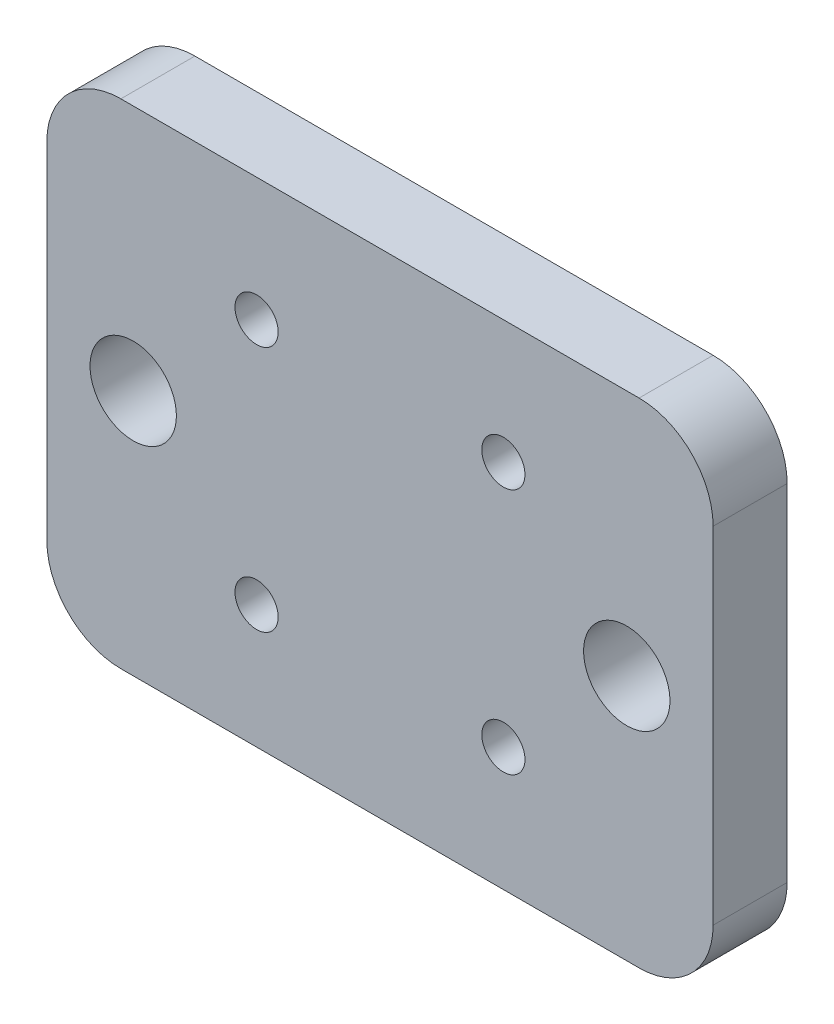
from build123d import *

# Parameters (mm, degrees)
ESQUISSE1_W                  = 54
ESQUISSE1_H                  = 40
BOSS_EXTRU_1_DEPTH           = 6
ENL_V_MAT_EXTRU_1_DEPTH      = 68.468511174
ENL_V_MAT_EXTRU_1_DEPTH_BACK = 68.468511174
ESQUISSE2_R                  = 1.75
ESQUISSE2_R_2                = 3.5
CONG_1_R                     = 6


with BuildPart() as part:
    # Esquisse1 → Boss.-Extru.1 (new body)
    with BuildSketch(Plane.XY):
        with Locations((27, 20)):
            Rectangle(ESQUISSE1_W, ESQUISSE1_H)
    extrude(amount=BOSS_EXTRU_1_DEPTH)

    # Esquisse2 → Enlèv. mat.-Extru.1 (cut, two sides: drawn at the far end of the back side and taken through both)
    with BuildSketch(Plane.XY.offset(6).offset(-ENL_V_MAT_EXTRU_1_DEPTH_BACK)):
        with Locations((17, 30)):
            Circle(ESQUISSE2_R)
        with Locations((37, 30)):
            Circle(ESQUISSE2_R)
        with Locations((37, 10)):
            Circle(ESQUISSE2_R)
        with Locations((17, 10)):
            Circle(ESQUISSE2_R)
        with Locations((7, 20)):
            Circle(ESQUISSE2_R_2)
        with Locations((47, 20)):
            Circle(ESQUISSE2_R_2)
    extrude(amount=ENL_V_MAT_EXTRU_1_DEPTH + ENL_V_MAT_EXTRU_1_DEPTH_BACK, mode=Mode.SUBTRACT)

    # Congé1
    cong_1_edges = [part.edges().sort_by_distance(p)[0] for p in [
        (54, 40, 3),
        (54, 0, 3),
        (0, 0, 3),
        (0, 40, 3),
    ]]
    fillet(cong_1_edges, radius=CONG_1_R)


solid = part.part
